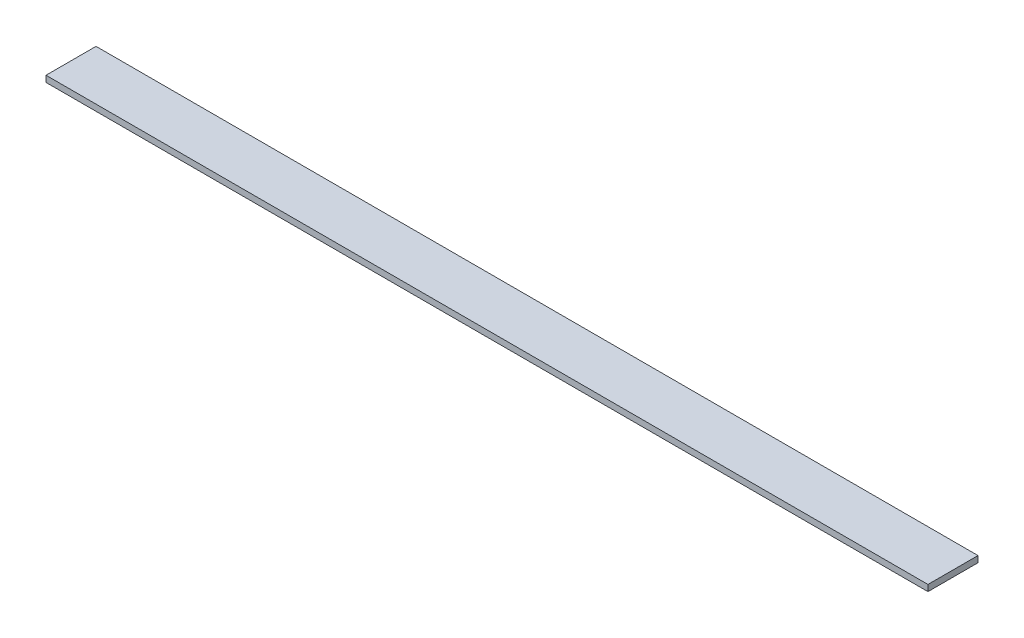
from build123d import *

# Parameters (mm, degrees)
SKETCH1_W          = 447.6496
SKETCH1_H          = 25.4
BASE_FLANGE1_DEPTH = 3.175


# Sheet-metal steps are written as plain solids
with BuildPart() as part:
    # Sketch1 → Base-Flange1 (new body)
    with BuildSketch(Plane(origin=(0, 0, 0), x_dir=(1, 0, 0), z_dir=(0, 1, 0))):
        Rectangle(SKETCH1_W, SKETCH1_H)
    extrude(amount=-BASE_FLANGE1_DEPTH)


solid = part.part
